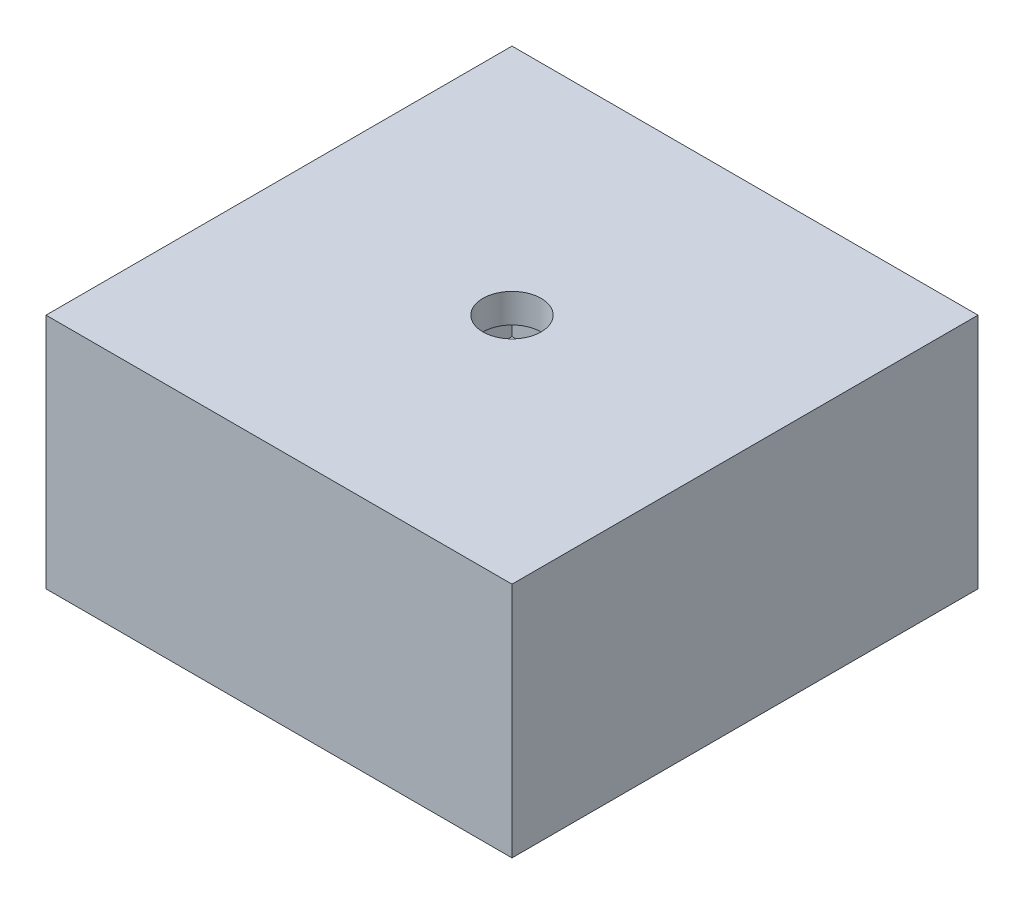
from build123d import *

# Parameters (mm, degrees)
SKETCH1_W           = 203.2
SKETCH1_H           = 203.2
SKETCH1_W_2         = 190.5
SKETCH1_H_2         = 190.5
BOSS_EXTRUDE1_DEPTH = 90.678
SKETCH2_W           = 203.2
SKETCH2_H           = 203.2
BOSS_EXTRUDE2_DEPTH = 12.7
SKETCH4_R           = 12.7
CUT_EXTRUDE3_DEPTH  = 178.008844084


with BuildPart() as part:
    # Sketch1 → Boss-Extrude1 (new body)
    with BuildSketch(Plane(origin=(0, 0, 0), x_dir=(1, 0, 0), z_dir=(0, 1, 0))):
        Rectangle(SKETCH1_W, SKETCH1_H)
        Rectangle(SKETCH1_W_2, SKETCH1_H_2, mode=Mode.SUBTRACT)
    extrude(amount=BOSS_EXTRUDE1_DEPTH)

    # Sketch2 → Boss-Extrude2 (add)
    with BuildSketch(Plane(origin=(0, 90.678, 0), x_dir=(1, 0, 0), z_dir=(0, 1, 0))):
        Rectangle(SKETCH2_W, SKETCH2_H)
    extrude(amount=BOSS_EXTRUDE2_DEPTH)

    # Sketch4 → Cut-Extrude3 (cut, through all)
    with BuildSketch(Plane(origin=(0, 103.378, 0), x_dir=(1, 0, 0), z_dir=(0, 1, 0))):
        Circle(SKETCH4_R)
    extrude(amount=-CUT_EXTRUDE3_DEPTH, mode=Mode.SUBTRACT)


solid = part.part
